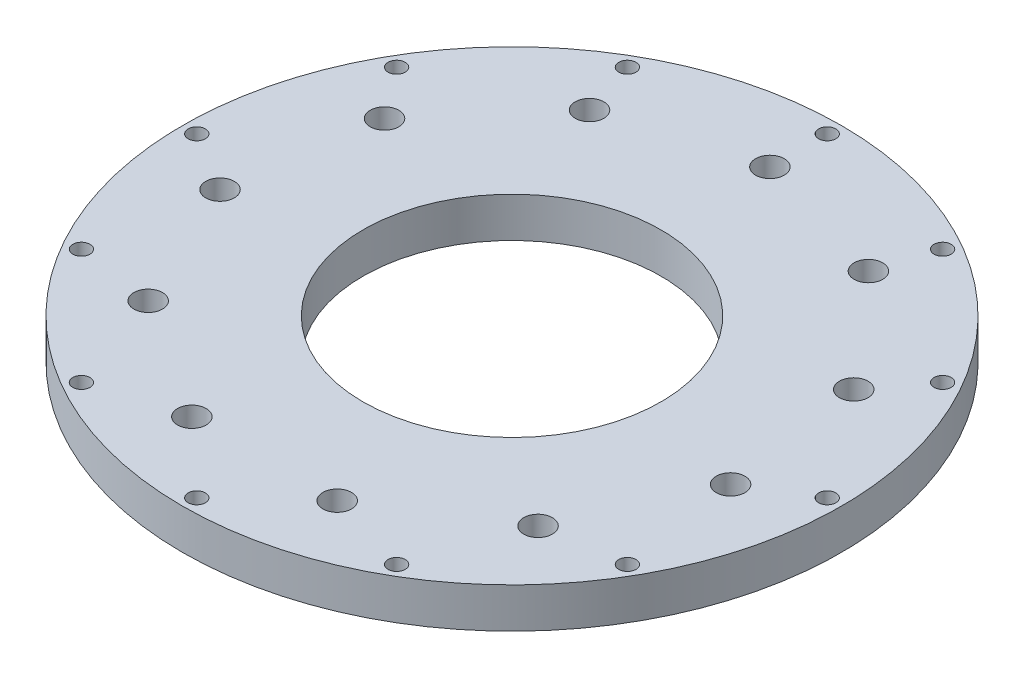
from build123d import *

# Parameters (mm, degrees)
SKETCH1_R           = 57.5
SKETCH1_R_2         = 1.5
SKETCH1_R_3         = 26
SKETCH1_R_4         = 2.5
BOSS_EXTRUDE1_DEPTH = 7


with BuildPart() as part:
    # Sketch1 → Boss-Extrude1 (new body)
    with BuildSketch(Plane(origin=(0, 0, 0), x_dir=(1, 0, 0), z_dir=(0, 1, 0))):
        Circle(SKETCH1_R)
        with Locations((0, 55)):
            Circle(SKETCH1_R_2, mode=Mode.SUBTRACT)
        with Locations((27.5, 47.631397208)):
            Circle(SKETCH1_R_2, mode=Mode.SUBTRACT)
        with Locations((47.631397208, 27.5)):
            Circle(SKETCH1_R_2, mode=Mode.SUBTRACT)
        with Locations((55, 0)):
            Circle(SKETCH1_R_2, mode=Mode.SUBTRACT)
        with Locations((47.631397208, -27.5)):
            Circle(SKETCH1_R_2, mode=Mode.SUBTRACT)
        with Locations((27.5, -47.631397208)):
            Circle(SKETCH1_R_2, mode=Mode.SUBTRACT)
        with Locations((0, -55)):
            Circle(SKETCH1_R_2, mode=Mode.SUBTRACT)
        with Locations((-27.5, -47.631397208)):
            Circle(SKETCH1_R_2, mode=Mode.SUBTRACT)
        with Locations((-47.631397208, -27.5)):
            Circle(SKETCH1_R_2, mode=Mode.SUBTRACT)
        with Locations((-55, 0)):
            Circle(SKETCH1_R_2, mode=Mode.SUBTRACT)
        with Locations((-47.631397208, 27.5)):
            Circle(SKETCH1_R_2, mode=Mode.SUBTRACT)
        with Locations((-27.5, 47.631397208)):
            Circle(SKETCH1_R_2, mode=Mode.SUBTRACT)
        Circle(SKETCH1_R_3, mode=Mode.SUBTRACT)
        with Locations((0, 45)):
            Circle(SKETCH1_R_4, mode=Mode.SUBTRACT)
        with Locations((24.328836786, 37.856408977)):
            Circle(SKETCH1_R_4, mode=Mode.SUBTRACT)
        with Locations((40.933439791, 18.693675585)):
            Circle(SKETCH1_R_4, mode=Mode.SUBTRACT)
        with Locations((44.541964885, -6.404167722)):
            Circle(SKETCH1_R_4, mode=Mode.SUBTRACT)
        with Locations((34.008730846, -29.468733028)):
            Circle(SKETCH1_R_4, mode=Mode.SUBTRACT)
        with Locations((12.677965058, -43.177183813)):
            Circle(SKETCH1_R_4, mode=Mode.SUBTRACT)
        with Locations((-12.677965058, -43.177183813)):
            Circle(SKETCH1_R_4, mode=Mode.SUBTRACT)
        with Locations((-34.008730846, -29.468733028)):
            Circle(SKETCH1_R_4, mode=Mode.SUBTRACT)
        with Locations((-44.541964885, -6.404167722)):
            Circle(SKETCH1_R_4, mode=Mode.SUBTRACT)
        with Locations((-40.933439791, 18.693675585)):
            Circle(SKETCH1_R_4, mode=Mode.SUBTRACT)
        with Locations((-24.328836786, 37.856408977)):
            Circle(SKETCH1_R_4, mode=Mode.SUBTRACT)
    extrude(amount=BOSS_EXTRUDE1_DEPTH)


solid = part.part
